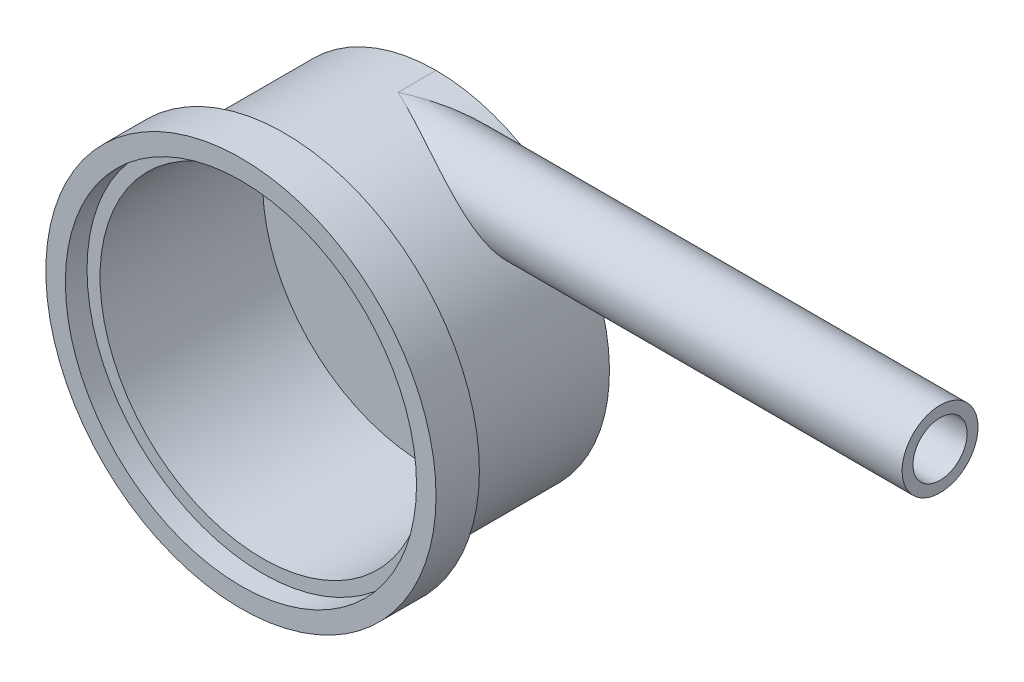
from build123d import *
from build123d.topology import SkipClean

# Parameters (mm, degrees)
SKETCH1_R                       = 16
BOSS_EXTRUDE_CAVITY_DEPTH       = 15
SKETCH2_R                       = 3.5
BOSS_EXTRUDE_INLET_DEPTH        = 50
CUT_EXTRUDE1_CAVITY_DEPTH       = 55.881691085
CUT_EXTRUDE1_CAVITY_DEPTH_BACK  = 55.881691085
SKETCH3_R                       = 15
CUT_EXTRUDE2_INLET_REACH        = 71.549
SKETCH4_R                       = 2.5
BOSS_EXTRUDE3_START             = 1
SKETCH5_R                       = 16
BOSS_EXTRUDE3_CAVITY_WALL_DEPTH = 1
BOSS_EXTRUDE4_START             = -2
SKETCH6_R                       = 18
SKETCH6_R_2                     = 16
BOSS_EXTRUDE4_DEPTH             = 2
SKETCH7_R                       = 18
SKETCH7_R_2                     = 16.2
BOSS_EXTRUDE5_DEPTH             = 2


with BuildPart() as part:
    # Sketch1 → Boss-Extrude Cavity (new body)
    with BuildSketch(Plane.XY):
        Circle(SKETCH1_R)
    extrude(amount=BOSS_EXTRUDE_CAVITY_DEPTH)

    # Sketch2 → Boss-Extrude Inlet (add)
    with BuildSketch(Plane(origin=(0, 0, 0), x_dir=(0, 0, -1), z_dir=(1, 0, 0))):
        with Locations((-2.5, 12.5)):
            Circle(SKETCH2_R)
    extrude(amount=BOSS_EXTRUDE_INLET_DEPTH)

    # Sketch3 → Cut-Extrude1 Cavity (cut, two sides: drawn at the far end of the back side and taken through both)
    with BuildSketch(Plane.XY.offset(15).offset(-CUT_EXTRUDE1_CAVITY_DEPTH_BACK)):
        Circle(SKETCH3_R)
    extrude(amount=CUT_EXTRUDE1_CAVITY_DEPTH + CUT_EXTRUDE1_CAVITY_DEPTH_BACK, mode=Mode.SUBTRACT)

    # Sketch4 → Cut-Extrude2 Inlet (cut, up to next)
    with BuildSketch(Plane(origin=(50, 0, 0), x_dir=(0, 0, -1), z_dir=(1, 0, 0)), mode=Mode.PRIVATE) as cut_extrude2_inlet_sk1:
        with Locations((-2.5, 12.5)):
            Circle(SKETCH4_R)
    cut_extrude2_inlet_tool1 = extrude(cut_extrude2_inlet_sk1.sketch, amount=-CUT_EXTRUDE2_INLET_REACH, mode=Mode.PRIVATE) & part.part
    add(cut_extrude2_inlet_tool1.solids().sort_by_distance((50, 12.5, 2.5))[0], mode=Mode.SUBTRACT)

    # Sketch5 → Boss-Extrude3 Cavity Wall (add)
    with SkipClean():  # the faces are left unmerged after this step: merging them gives an invalid solid
        with BuildSketch(Plane(origin=(0, 0, 0), x_dir=(-1, 0, 0), z_dir=(0, 0, -1)).offset(BOSS_EXTRUDE3_START)):
            Circle(SKETCH5_R)
        extrude(amount=-BOSS_EXTRUDE3_CAVITY_WALL_DEPTH)
    add(part.part.scale(1), mode=Mode.REPLACE)  # the faces are merged on a copy

    # Sketch6 → Boss-Extrude4 (add)
    with BuildSketch(Plane.XY.offset(15).offset(BOSS_EXTRUDE4_START)):
        Circle(SKETCH6_R)
        Circle(SKETCH6_R_2, mode=Mode.SUBTRACT)
    extrude(amount=BOSS_EXTRUDE4_DEPTH)

    # Sketch7 → Boss-Extrude5 (add)
    with BuildSketch(Plane.XY.offset(15)):
        Circle(SKETCH7_R)
        Circle(SKETCH7_R_2, mode=Mode.SUBTRACT)
    extrude(amount=BOSS_EXTRUDE5_DEPTH)


solid = part.part
